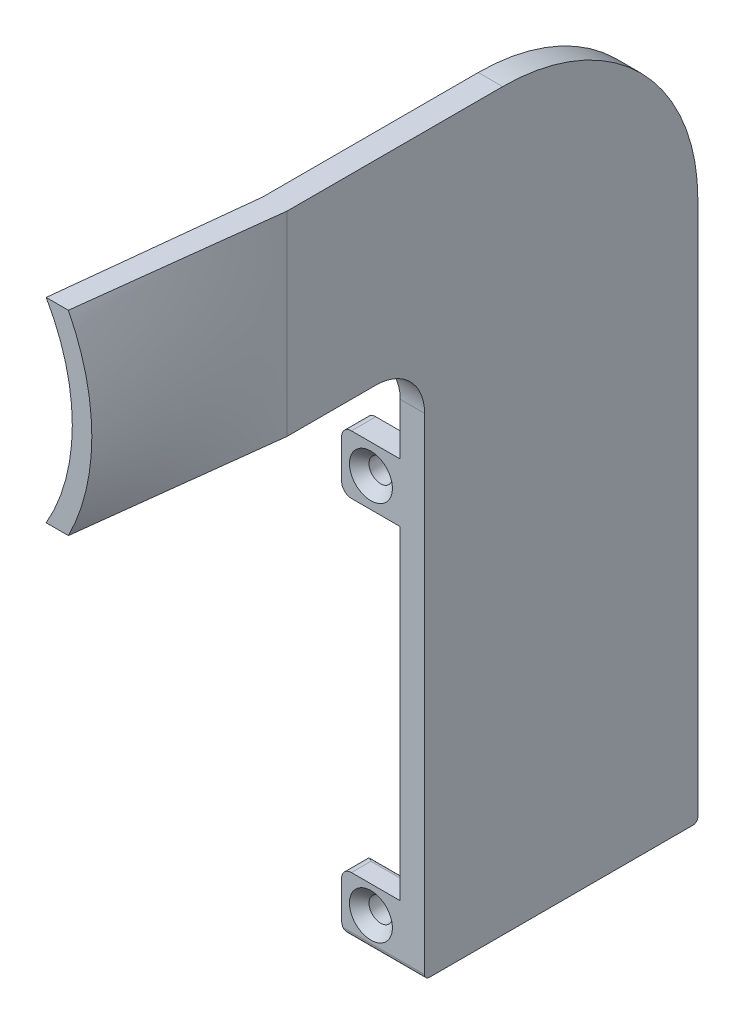
from build123d import *
from OCP.BRepFilletAPI import BRepFilletAPI_MakeFillet

# Parameters (mm, degrees)
SKETCH1_W                                           = 2.5
SKETCH1_H                                           = 6
BOSS_EXTRUDE1_DEPTH                                 = 6
SKETCH1_H_2                                         = 5.8
BOSS_EXTRUDE1_2_DEPTH                               = 6
BOSS_EXTRUDE1_3_DEPTH                               = 6
BOSS_EXTRUDE1_4_DEPTH                               = 6
SKETCH2_W                                           = 28
SKETCH2_H                                           = 45
BOSS_EXTRUDE2_DEPTH                                 = 2.5
BOSS_EXTRUDE3_DEPTH                                 = 2.5
CSK_FOR_M2_COUNTERSUNK_FLAT_HEAD_SCREW1_D           = 2.4
CSK_FOR_M2_COUNTERSUNK_FLAT_HEAD_SCREW1_DEPTH       = 4
CSK_FOR_M2_COUNTERSUNK_FLAT_HEAD_SCREW1_CSINK_D     = 4.4
CSK_FOR_M2_COUNTERSUNK_FLAT_HEAD_SCREW1_CSINK_ANGLE = 90
CSK_FOR_M2_COUNTERSUNK_FLAT_HEAD_SCREW1_TIP         = 0.721032743
CSK_FOR_M2_COUNTERSUNK_FLAT_HEAD_SCREW2_D           = 2.4
CSK_FOR_M2_COUNTERSUNK_FLAT_HEAD_SCREW2_DEPTH       = 4
CSK_FOR_M2_COUNTERSUNK_FLAT_HEAD_SCREW2_CSINK_D     = 4.4
CSK_FOR_M2_COUNTERSUNK_FLAT_HEAD_SCREW2_CSINK_ANGLE = 90
CSK_FOR_M2_COUNTERSUNK_FLAT_HEAD_SCREW2_TIP         = 0.721032743
FILLET1_R1                                          = 20
FILLET1_R2                                          = 5
FILLET2_R                                           = 1
FILLET3_R                                           = 0.5


with BuildPart() as part:
    # Sketch1 → Boss-Extrude1 (new body)
    with BuildSketch(Plane(origin=(30.100472417, 0, 0), x_dir=(0, 0, -1), z_dir=(1, 0, 0))):
        with Locations((-27.476835801, 55.903969126)):
            Rectangle(SKETCH1_W, SKETCH1_H)
    extrude(amount=BOSS_EXTRUDE1_DEPTH)



with BuildPart() as body_2:
    # Sketch1 → Boss-Extrude1 2 (new body)
    with BuildSketch(Plane(origin=(30.100472417, 0, 0), x_dir=(0, 0, -1), z_dir=(1, 0, 0))):
        with Locations((-27.476835801, 16.803969126)):
            Rectangle(SKETCH1_W, SKETCH1_H_2)
    extrude(amount=BOSS_EXTRUDE1_2_DEPTH)


with BuildPart() as body_3:
    # Sketch1 → Boss-Extrude1 3 (new body)
    with BuildSketch(Plane(origin=(30.100472417, 0, 0), x_dir=(0, 0, -1), z_dir=(1, 0, 0))):
        with Locations((-52.976835801, 16.803969126)):
            Rectangle(SKETCH1_W, SKETCH1_H_2)
    extrude(amount=BOSS_EXTRUDE1_3_DEPTH)


with BuildPart() as body_4:
    # Sketch1 → Boss-Extrude1 4 (new body)
    with BuildSketch(Plane(origin=(30.100472417, 0, 0), x_dir=(0, 0, -1), z_dir=(1, 0, 0))):
        with Locations((-52.976835801, 55.903969126)):
            Rectangle(SKETCH1_W, SKETCH1_H)
    extrude(amount=BOSS_EXTRUDE1_4_DEPTH)


with BuildPart() as part_1:
    add(part.part)

    add(body_2.part)  # Boss-Extrude2 merges body 2

    add(body_3.part)  # Boss-Extrude2 merges body 3

    add(body_4.part)  # Boss-Extrude2 merges body 4
    # Sketch2 → Boss-Extrude2 (add)
    with BuildSketch(Plane(origin=(36.100472417, 0, 0), x_dir=(0, 0, -1), z_dir=(1, 0, 0))):
        with Locations((-40.226835801, 36.403969126)):
            Rectangle(SKETCH2_W, SKETCH2_H)
    extrude(amount=BOSS_EXTRUDE2_DEPTH)

    # Sketch3 → Boss-Extrude3 (add)
    with BuildSketch(Plane(origin=(38.600472417, 0, 0), x_dir=(0, 0, -1), z_dir=(1, 0, 0))):
        Polygon((-68.326835801, 89.203969126), (-26.226835801, 89.203969126), (-26.226835801, 58.903969126), (-54.226835801, 58.903969126), (-54.226835801, 69.203969126), (-68.326835801, 69.203969126), align=None)
    extrude(amount=-BOSS_EXTRUDE3_DEPTH)

    # CSK for M2 Countersunk Flat Head Screw1
    with Locations(Plane.XY.offset(54.226835801)):
        with Locations((33.100472417, 55.903969126), (33.100472417, 16.903969126)):
            CounterSinkHole(CSK_FOR_M2_COUNTERSUNK_FLAT_HEAD_SCREW1_D / 2, CSK_FOR_M2_COUNTERSUNK_FLAT_HEAD_SCREW1_CSINK_D / 2, depth=CSK_FOR_M2_COUNTERSUNK_FLAT_HEAD_SCREW1_DEPTH, counter_sink_angle=CSK_FOR_M2_COUNTERSUNK_FLAT_HEAD_SCREW1_CSINK_ANGLE)
            with Locations((0, 0, -(CSK_FOR_M2_COUNTERSUNK_FLAT_HEAD_SCREW1_DEPTH + CSK_FOR_M2_COUNTERSUNK_FLAT_HEAD_SCREW1_TIP / 2))):  # 118° drill point
                Cone(0, CSK_FOR_M2_COUNTERSUNK_FLAT_HEAD_SCREW1_D / 2, CSK_FOR_M2_COUNTERSUNK_FLAT_HEAD_SCREW1_TIP, mode=Mode.SUBTRACT)

    # CSK for M2 Countersunk Flat Head Screw2
    with Locations(Plane(origin=(0, 0, 26.226835801), x_dir=(-1, 0, 0), z_dir=(0, 0, -1))):
        with Locations((-33.100472417, 55.903969126), (-33.100472417, 16.903969126)):
            CounterSinkHole(CSK_FOR_M2_COUNTERSUNK_FLAT_HEAD_SCREW2_D / 2, CSK_FOR_M2_COUNTERSUNK_FLAT_HEAD_SCREW2_CSINK_D / 2, depth=CSK_FOR_M2_COUNTERSUNK_FLAT_HEAD_SCREW2_DEPTH, counter_sink_angle=CSK_FOR_M2_COUNTERSUNK_FLAT_HEAD_SCREW2_CSINK_ANGLE)
            with Locations((0, 0, -(CSK_FOR_M2_COUNTERSUNK_FLAT_HEAD_SCREW2_DEPTH + CSK_FOR_M2_COUNTERSUNK_FLAT_HEAD_SCREW2_TIP / 2))):  # 118° drill point
                Cone(0, CSK_FOR_M2_COUNTERSUNK_FLAT_HEAD_SCREW2_D / 2, CSK_FOR_M2_COUNTERSUNK_FLAT_HEAD_SCREW2_TIP, mode=Mode.SUBTRACT)

    # Fillet1: one fillet with a radius per group of edges: ONE call of the kernel's fillet builder (fillet() takes one radius for all edges)
    fillet1_edges_1 = [part_1.edges().sort_by_distance(p)[0] for p in [
        (37.350472417, 89.203969126, 26.226835801),
    ]]
    fillet1_edges_2 = [part_1.edges().sort_by_distance(p)[0] for p in [
        (37.350472417, 69.203969126, 54.226835801),
    ]]
    fillet1 = BRepFilletAPI_MakeFillet(part_1.part.solid().wrapped)
    for e in fillet1_edges_1:
        fillet1.Add(FILLET1_R1, e.wrapped)
    for e in fillet1_edges_2:
        fillet1.Add(FILLET1_R2, e.wrapped)
    add(Compound.cast(fillet1.Shape()), mode=Mode.REPLACE)

    # Loft1: read off the stored shape, not the designer's step
    # Loft1: loft between two sections, ruled curve by curve
    loft1_from = [
        Edge.make_bspline([(36.19639036, 89.203969126, 88.326835801), (36.953966117, 87.719429888, 88.326835801), (37.561920044, 86.105994191, 88.326835801), (38.385620937, 82.729240829, 88.326835801), (38.600472417, 80.966962635, 88.326835801), (38.600472417, 77.440975617, 88.326835801), (38.385620937, 75.678697423, 88.326835801), (37.561920044, 72.30194406, 88.326835801), (36.953966117, 70.688508364, 88.326835801), (36.19639036, 69.203969126, 88.326835801)], [0, 0, 0, 0, 0.25, 0.25, 0.5, 0.5, 0.75, 0.75, 1, 1, 1, 1], 3),
        Edge.make_bspline([(33.920980493, 69.203969126, 88.326835801), (34.754313826, 70.647344799, 88.326835801), (35.433250093, 72.246533252, 88.326835801), (36.357078765, 75.632424009, 88.326835801), (36.600472417, 77.417641176, 88.326835801), (36.600472417, 80.990297075, 88.326835801), (36.357078765, 82.775514243, 88.326835801), (35.433250093, 86.161405, 88.326835801), (34.754313826, 87.760593453, 88.326835801), (33.920980493, 89.203969126, 88.326835801)], [0, 0, 0, 0, 0.25, 0.25, 0.5, 0.5, 0.75, 0.75, 1, 1, 1, 1], 3),
        Edge.make_line((33.920980493, 69.203969126, 88.326835801), (36.19639036, 69.203969126, 88.326835801)),
        Edge.make_line((33.920980493, 89.203969126, 88.326835801), (36.19639036, 89.203969126, 88.326835801)),
    ]
    loft1_to = [
        Edge.make_bspline([(38.600472417, 89.203969126, 68.326835801), (38.600472417, 87.537302459, 68.326835801), (38.600472417, 85.870635792, 68.326835801), (38.600472417, 82.537302459, 68.326835801), (38.600472417, 80.870635792, 68.326835801), (38.600472417, 77.537302459, 68.326835801), (38.600472417, 75.870635792, 68.326835801), (38.600472417, 72.537302459, 68.326835801), (38.600472417, 70.870635792, 68.326835801), (38.600472417, 69.203969126, 68.326835801)], [0, 0, 0, 0, 0.25, 0.25, 0.5, 0.5, 0.75, 0.75, 1, 1, 1, 1], 3),
        Edge.make_bspline([(36.100472417, 69.203969126, 68.326835801), (36.100472417, 70.870635792, 68.326835801), (36.100472417, 72.537302459, 68.326835801), (36.100472417, 75.870635792, 68.326835801), (36.100472417, 77.537302459, 68.326835801), (36.100472417, 80.870635792, 68.326835801), (36.100472417, 82.537302459, 68.326835801), (36.100472417, 85.870635792, 68.326835801), (36.100472417, 87.537302459, 68.326835801), (36.100472417, 89.203969126, 68.326835801)], [0, 0, 0, 0, 0.25, 0.25, 0.5, 0.5, 0.75, 0.75, 1, 1, 1, 1], 3),
        Edge.make_line((36.100472417, 69.203969126, 68.326835801), (38.600472417, 69.203969126, 68.326835801)),
        Edge.make_line((36.100472417, 89.203969126, 68.326835801), (38.600472417, 89.203969126, 68.326835801)),
    ]
    loft1 = Solid(Shell([*[Face.make_surface_from_curves(loft1_from[k], loft1_to[k]) for k in range(4)], Face(Wire(loft1_from)), Face(Wire(loft1_to))]))
    add(loft1)

    # Fillet2
    fillet2_edges = [part_1.edges().sort_by_distance(p)[0] for p in [
        (30.100472417, 58.903969126, 27.476835801),
        (30.100472417, 52.903969126, 27.476835801),
        (30.100472417, 19.703969126, 27.476835801),
        (30.100472417, 13.903969126, 27.476835801),
        (30.100472417, 13.903969126, 52.976835801),
        (30.100472417, 19.703969126, 52.976835801),
        (30.100472417, 52.903969126, 52.976835801),
        (30.100472417, 58.903969126, 52.976835801),
    ]]
    fillet(fillet2_edges, radius=FILLET2_R)

    # Fillet3
    # the kernel refuses this fillet: 0.5 mm, written as the material it takes off along each edge
    with BuildSketch(Plane(origin=(29.850472417, 52.903969126, 28.726835801), x_dir=(0, 1, 0), z_dir=(1, 0, 0)), Plane(origin=(29.850472417, 52.903969126, 51.726835801), x_dir=(0, 0, 1), z_dir=(1, 0, 0))) as fillet3_piece_1:
        with BuildLine():
            CenterArc((FILLET3_R, -FILLET3_R), FILLET3_R, 90, 90)
            Line((0, -FILLET3_R), (0, 0))
            Line((0, 0), (FILLET3_R, 0))
        make_face()
    extrude(amount=6.25, mode=Mode.SUBTRACT)
    with BuildSketch(Plane(origin=(39.850472417, 13.903969126, 26.226835801), x_dir=(0, 0, 1), z_dir=(-1, 0, 0)), Plane(origin=(39.850472417, 13.903969126, 54.226835801), x_dir=(0, 1, 0), z_dir=(-1, 0, 0))) as fillet3_piece_2:
        with BuildLine():
            CenterArc((FILLET3_R, FILLET3_R), FILLET3_R, 180, 90)
            Line((0, FILLET3_R), (0, 0))
            Line((0, 0), (FILLET3_R, 0))
        make_face()
    extrude(amount=10, mode=Mode.SUBTRACT)
    with BuildSketch(Plane(origin=(29.850472417, 19.703969126, 28.726835801), x_dir=(0, -1, 0), z_dir=(1, 0, 0)), Plane(origin=(29.850472417, 19.703969126, 51.726835801), x_dir=(0, 0, 1), z_dir=(1, 0, 0))) as fillet3_piece_3:
        with BuildLine():
            CenterArc((FILLET3_R, FILLET3_R), FILLET3_R, 180, 90)
            Line((0, FILLET3_R), (0, 0))
            Line((0, 0), (FILLET3_R, 0))
        make_face()
    extrude(amount=6.25, mode=Mode.SUBTRACT)


solid = part_1.part
